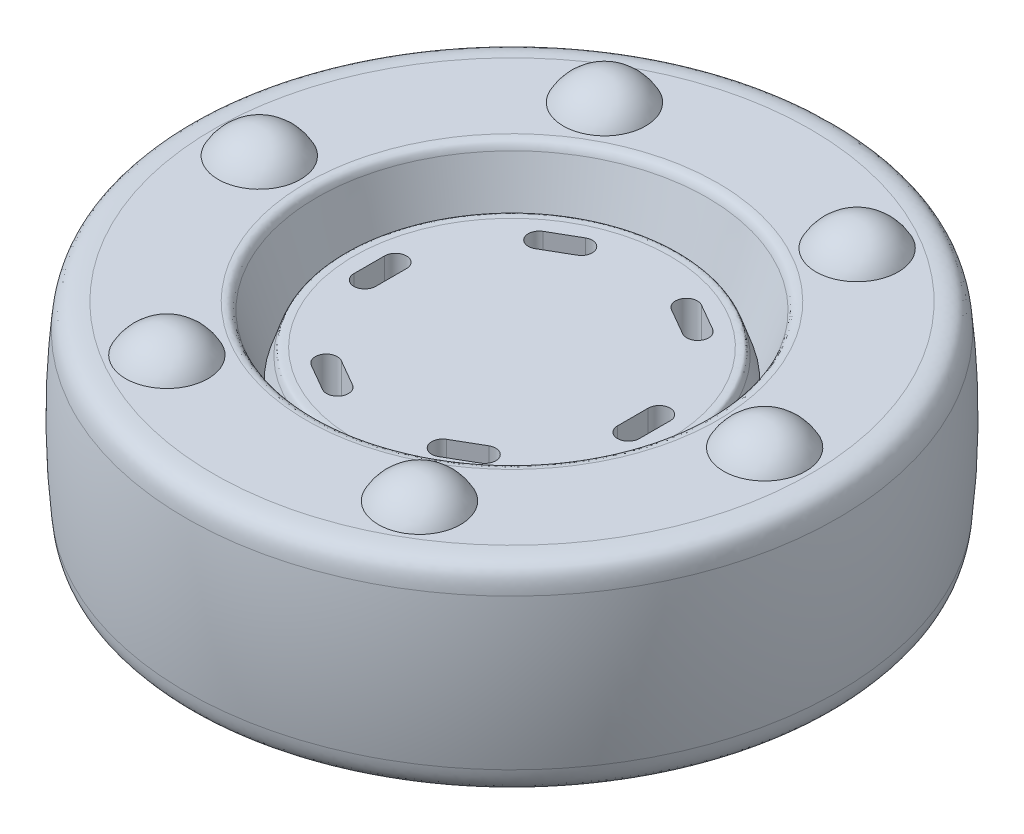
from build123d import *
from build123d.topology import SkipClean

# Parameters (mm, degrees)
CUT_EXTRUDE1_DEPTH = 55.400046546
CIRPATTERN1_COUNT  = 6


with BuildPart() as part:
    # Sketch1 → Revolve1 (revolve)
    with BuildSketch(Plane.XY, mode=Mode.PRIVATE) as revolve1_sk:
        with BuildLine():
            Line((0, 6.985), (19.177, 6.985))
            Line((19.177, 6.985), (20.247639535, 3.81))
            Line((20.247639535, 3.81), (22.86, 11.557))
            Line((22.86, 11.557), (37.338, 11.557))
            ThreePointArc((37.338, 11.557), (37.909293409, 5.791046818), (38.1, 0))
            Line((38.1, 0), (0, 0))
            Line((0, 0), (0, 6.985))
        make_face()
    revolve(revolve1_sk.sketch.rotate(Axis((0, 0, 0), (0, 1, 0)), 90), axis=Axis((0, 0, 0), (0, 1, 0)))

    # Fillet1
    # a fillet whose section is not a circle: 3.175 mm, written as the material it takes off along each edge
    with BuildSketch(Plane(origin=(0, 11.557, 0), x_dir=(0, 0, -1), z_dir=(1, 0, 0))) as fillet1_piece_1:
        with BuildLine():
            Bezier((34.509955675, 0), (37.385362839, 0), (37.669424517, -2.861341524), weights=[1, 1.5, 1])
            ThreePointArc((37.669424517, -2.861341524), (37.515417577, -1.429314954), (37.338, 0))
            Line((37.338, 0), (34.509955675, 0))
        make_face()
    revolve(axis=Axis((0, 11.557, 0), (0, 1, 0)), mode=Mode.SUBTRACT)

    # Sketch2 → Revolve4 (revolve)
    with SkipClean():  # the faces are left unmerged after this step: merging them gives an invalid solid
        with BuildSketch(Plane.XY):
            with BuildLine():
                ThreePointArc((34.544, 9.144), (32.981707571, 12.915707571), (29.21, 14.478))
                Line((29.21, 14.478), (29.21, 3.81))
                ThreePointArc((29.21, 3.81), (32.981707571, 5.372292429), (34.544, 9.144))
            make_face()
            with BuildLine():
                Line((29.21, 3.81), (29.21, 14.478))
                ThreePointArc((29.21, 14.478), (23.876, 9.144), (29.21, 3.81))
            make_face()
        revolve4 = revolve(axis=Axis((29.21, 14.478, 0), (0, -1, 0)))

    # Fillet2
    # a fillet whose section is not a circle: 1.27 mm, written as the material it takes off along each edge
    with BuildSketch(Plane(origin=(0, 11.557, 0), x_dir=(0, 0, -1), z_dir=(1, 0, 0))) as fillet2_piece_1:
        with BuildLine():
            Bezier((23.77200649, 0), (22.86, 0), (22.568585341, -0.864195194), weights=[1, 1.5, 1])
            Line((22.568585341, -0.864195194), (22.86, 0))
            Line((22.86, 0), (23.77200649, 0))
        make_face()
    revolve(axis=Axis((0, 11.557, 0), (0, 1, 0)), mode=Mode.SUBTRACT)

    # Sketch3 → Cut-Extrude1 (cut, through all)
    with SkipClean():  # the faces are left unmerged after this step: merging them gives an invalid solid
        with BuildSketch(Plane(origin=(0, 6.985, 0), x_dir=(1, 0, 0), z_dir=(0, 1, 0))):
            with BuildLine():
                Line((16.51, 1.778), (16.51, -1.778))
                ThreePointArc((16.51, -1.778), (15.24, -3.048), (13.97, -1.778))
                Line((13.97, -1.778), (13.97, 1.778))
                ThreePointArc((13.97, 1.778), (15.24, 3.048), (16.51, 1.778))
            make_face()
        cut_extrude1 = extrude(amount=-CUT_EXTRUDE1_DEPTH, mode=Mode.SUBTRACT)

    # Fillet3
    # a fillet whose section is not a circle: 1.27 mm, written as the material it takes off along each edge
    with BuildSketch(Plane(origin=(0, 6.985, 0), x_dir=(0, 0, -1), z_dir=(1, 0, 0))) as fillet3_piece_1:
        with BuildLine():
            Bezier((18.26499351, 0), (19.177, 0), (19.468414659, -0.864195194), weights=[1, 4, 1])
            Line((19.468414659, -0.864195194), (19.177, 0))
            Line((19.177, 0), (18.26499351, 0))
        make_face()
    revolve(axis=Axis((0, 6.985, 0), (0, 1, 0)), mode=Mode.SUBTRACT)

    # CirPattern1: Revolve4, Cut-Extrude1 ×6 about axis
    with SkipClean():  # the faces are left unmerged after this step: merging them gives an invalid solid
        cirpattern1_axis = Axis((0, 0, 0), (0, 1, 0))
        add([revolve4.rotate(cirpattern1_axis, i * 360 / CIRPATTERN1_COUNT) for i in range(1, CIRPATTERN1_COUNT)])
        add([cut_extrude1.rotate(cirpattern1_axis, i * 360 / CIRPATTERN1_COUNT) for i in range(1, CIRPATTERN1_COUNT)], mode=Mode.SUBTRACT)

    # Mirror1: part across plane


with BuildPart() as part_1:
    with SkipClean():  # the faces are left unmerged after this step: merging them gives an invalid solid
        add(part.part)
        add(part.part.mirror(Plane.ZX))


solid = part_1.part
